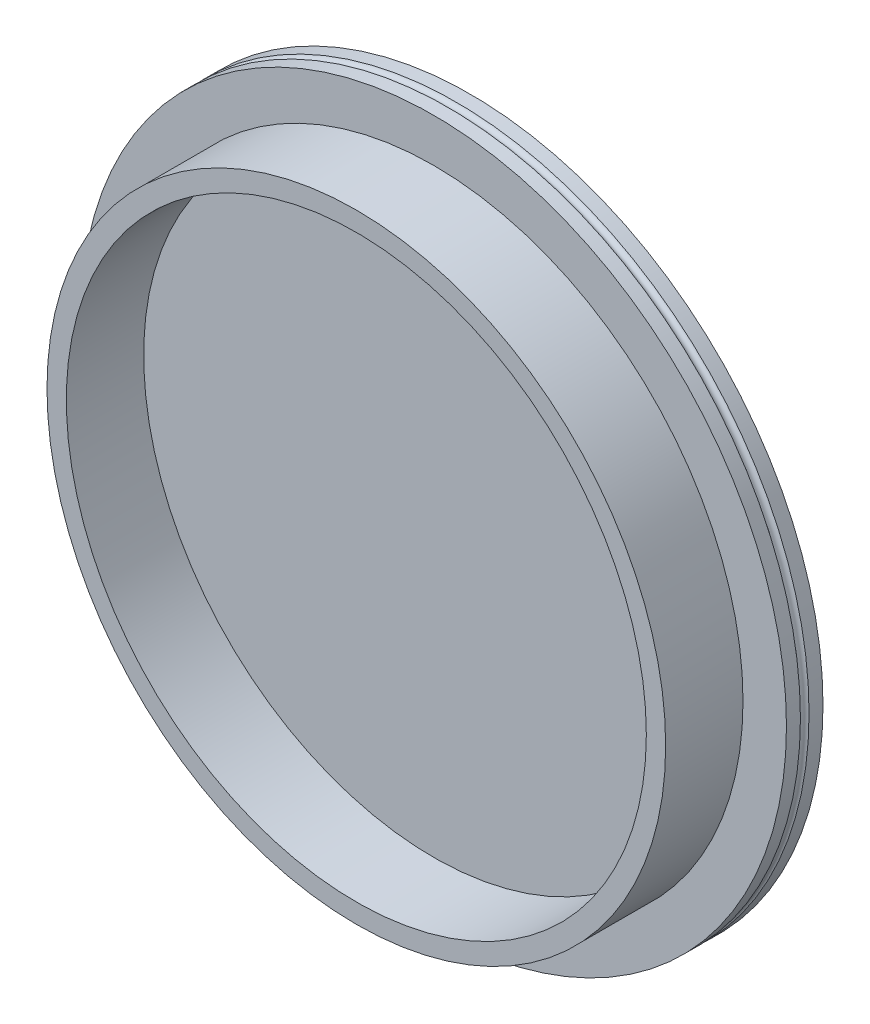
from build123d import *


with BuildPart() as part:
    # Sketch1 → Base-Revolve (revolve)
    with BuildSketch(Plane(origin=(0, 0, 0), x_dir=(0, 0, -1), z_dir=(1, 0, 0))):
        with BuildLine():
            Line((-4.585786438, 115.874999992), (0, 115.874999992))
            Line((0, 115.874999992), (0, 113.374999974))
            Line((0, 113.374999974), (-2, 113.374999974))
            Line((-2, 113.374999974), (-2, 107.374999974))
            Line((-2, 107.374999974), (0, 107.374999974))
            Line((0, 107.374999974), (0, 0))
            Line((0, 0), (-12, 0))
            Line((-12, 0), (-12, 95.25))
            Line((-12, 95.25), (-37.4, 95.25))
            Line((-37.4, 95.25), (-37.4, 101.6))
            Line((-37.4, 101.6), (-12, 101.6))
            Line((-12, 101.6), (-12, 115.874999992))
            Line((-12, 115.874999992), (-7.414213562, 115.874999992))
            ThreePointArc((-7.414213562, 115.874999992), (-6, 114.874999992), (-4.585786438, 115.874999992))
        make_face()
    revolve(axis=Axis((0, 0, 12), (0, 0, -1)))


solid = part.part
